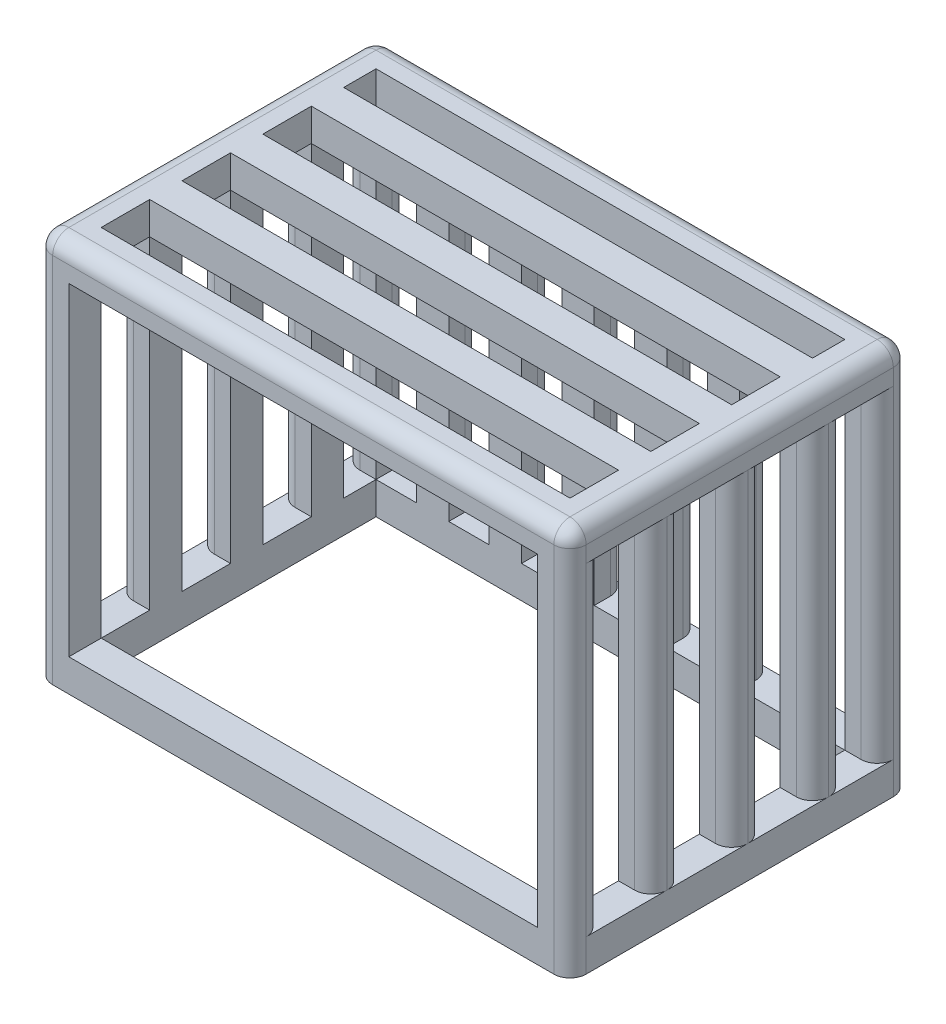
from build123d import *

# Parameters (mm, degrees)
SKETCH_1_W      = 33
SKETCH_1_H      = 21
SKETCH_1_W_2    = 29
SKETCH_1_H_2    = 17
EXTRUDE_1_DEPTH = 2
SKETCH_2_W      = 2
SKETCH_2_H      = 2
EXTRUDE_2_DEPTH = 20
SKETCH_3_W      = 33
SKETCH_3_H      = 21
SKETCH_3_W_2    = 29
SKETCH_3_H_2    = 2
SKETCH_3_H_3    = 3
EXTRUDE_6_DEPTH = 2
FILLET_2_R      = 1


with BuildPart() as part:
    # 草图1 → 凸台-拉伸1 (new body)
    with BuildSketch(Plane(origin=(0, 0, 0), x_dir=(1, 0, 0), z_dir=(0, 1, 0))):
        with Locations((16.5, -10.5)):
            Rectangle(SKETCH_1_W, SKETCH_1_H)
        with Locations((16.5, -10.5)):
            Rectangle(SKETCH_1_W_2, SKETCH_1_H_2, mode=Mode.SUBTRACT)
    extrude(amount=EXTRUDE_1_DEPTH)

    # 草图2 → 凸台-拉伸2 (add)
    with BuildSketch(Plane(origin=(0, 2, 0), x_dir=(1, 0, 0), z_dir=(0, 1, 0))):
        with Locations((1, -15)):
            Rectangle(SKETCH_2_W, SKETCH_2_H)
        with Locations((1, -20)):
            Rectangle(SKETCH_2_W, SKETCH_2_H)
        with Locations((1, -1)):
            Rectangle(SKETCH_2_W, SKETCH_2_H)
        with Locations((32, -1)):
            Rectangle(SKETCH_2_W, SKETCH_2_H)
        with Locations((32, -20)):
            Rectangle(SKETCH_2_W, SKETCH_2_H)
        with Locations((32, -15)):
            Rectangle(SKETCH_2_W, SKETCH_2_H)
        with Locations((1, -10)):
            Rectangle(SKETCH_2_W, SKETCH_2_H)
        with Locations((32, -10)):
            Rectangle(SKETCH_2_W, SKETCH_2_H)
        with Locations((1, -5)):
            Rectangle(SKETCH_2_W, SKETCH_2_H)
        with Locations((32, -5)):
            Rectangle(SKETCH_2_W, SKETCH_2_H)
        with Locations((5.5, -1)):
            Rectangle(SKETCH_2_W, SKETCH_2_H)
        with Locations((10, -1)):
            Rectangle(SKETCH_2_W, SKETCH_2_H)
        with Locations((14.5, -1)):
            Rectangle(SKETCH_2_W, SKETCH_2_H)
        with Locations((19, -1)):
            Rectangle(SKETCH_2_W, SKETCH_2_H)
        with Locations((23.5, -1)):
            Rectangle(SKETCH_2_W, SKETCH_2_H)
        with Locations((28, -1)):
            Rectangle(SKETCH_2_W, SKETCH_2_H)
    extrude(amount=EXTRUDE_2_DEPTH)

    # 草图3 → 凸台-拉伸6 (add)
    with BuildSketch(Plane(origin=(0, 22, 0), x_dir=(1, 0, 0), z_dir=(0, 1, 0))):
        with Locations((16.5, -10.5)):
            Rectangle(SKETCH_3_W, SKETCH_3_H)
        with Locations((16.5, -3)):
            Rectangle(SKETCH_3_W_2, SKETCH_3_H_2, mode=Mode.SUBTRACT)
        with Locations((16.5, -7.5)):
            Rectangle(SKETCH_3_W_2, SKETCH_3_H_3, mode=Mode.SUBTRACT)
        with Locations((16.5, -12.5)):
            Rectangle(SKETCH_3_W_2, SKETCH_3_H_3, mode=Mode.SUBTRACT)
        with Locations((16.5, -17.5)):
            Rectangle(SKETCH_3_W_2, SKETCH_3_H_3, mode=Mode.SUBTRACT)
    extrude(amount=EXTRUDE_6_DEPTH)

    # 圆角2
    fillet_2_edges = [part.edges().sort_by_distance(p)[0] for p in [
        (33, 12, 11),
        (33, 12, 9),
        (0, 12, 4),
        (0, 12, 6),
        (33, 12, 6),
        (33, 12, 4),
        (6.5, 12, 0),
        (4.5, 12, 0),
        (11, 12, 0),
        (9, 12, 0),
        (15.5, 12, 0),
        (13.5, 12, 0),
        (20, 12, 0),
        (18, 12, 0),
        (24.5, 12, 0),
        (22.5, 12, 0),
        (29, 12, 0),
        (27, 12, 0),
        (33, 24, 10.5),
        (16.5, 24, 0),
        (16.5, 24, 21),
        (0, 24, 10.5),
        (0, 12, 19),
        (0, 12, 2),
        (2, 12, 0),
        (33, 12, 2),
        (31, 12, 0),
        (33, 12, 19),
        (0, 12, 14),
        (0, 12, 16),
        (0, 12, 0),
        (33, 12, 0),
        (33, 12, 21),
        (0, 12, 21),
        (33, 12, 16),
        (33, 12, 14),
        (0, 12, 9),
        (0, 12, 11),
    ]]
    fillet(fillet_2_edges, radius=FILLET_2_R - 0.0001)  # a hair under: the kernel refuses the full size


solid = part.part
